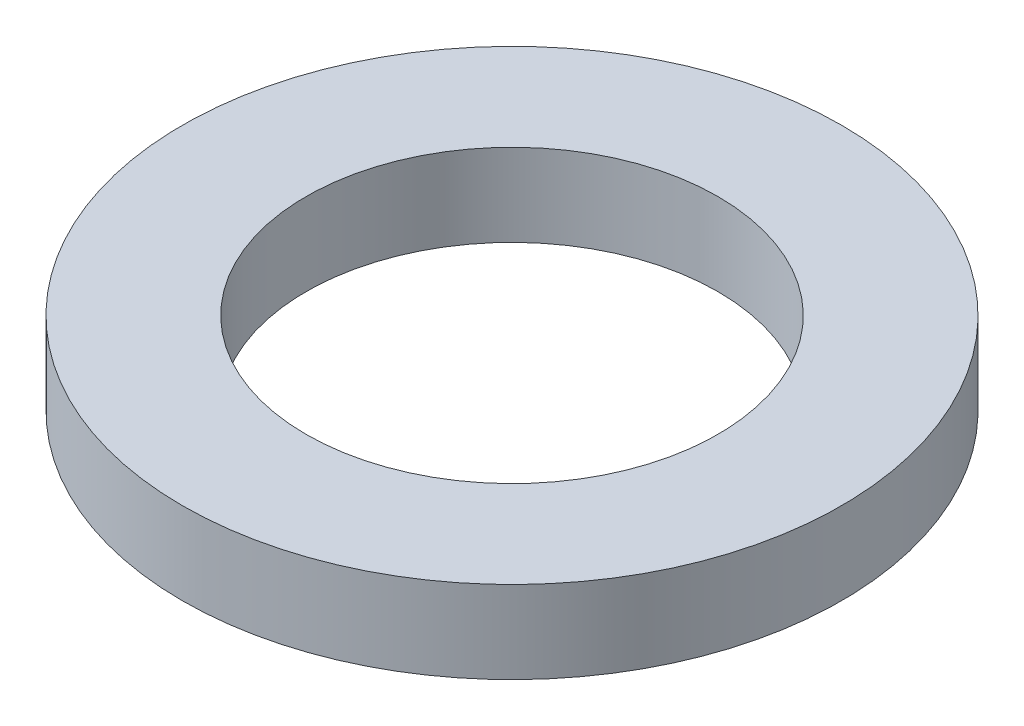
from build123d import *

# Parameters (mm, degrees)
EXTRUDE_1_DEPTH      = 0.5
EXTRUDE_1_DEPTH_BACK = 0.5
SKETCH_1_R           = 4
SKETCH_1_R_2         = 2.5


with BuildPart() as part:
    # Эскиз1 → Бобышка-Вытянуть1 (new, two sides: drawn at the far end of the back side and taken through both)
    with BuildSketch(Plane(origin=(0, 0, 0), x_dir=(1, 0, 0), z_dir=(0, 1, 0)).offset(-EXTRUDE_1_DEPTH_BACK)):
        Circle(SKETCH_1_R)
        Circle(SKETCH_1_R_2, mode=Mode.SUBTRACT)
    extrude(amount=EXTRUDE_1_DEPTH + EXTRUDE_1_DEPTH_BACK)


solid = part.part
